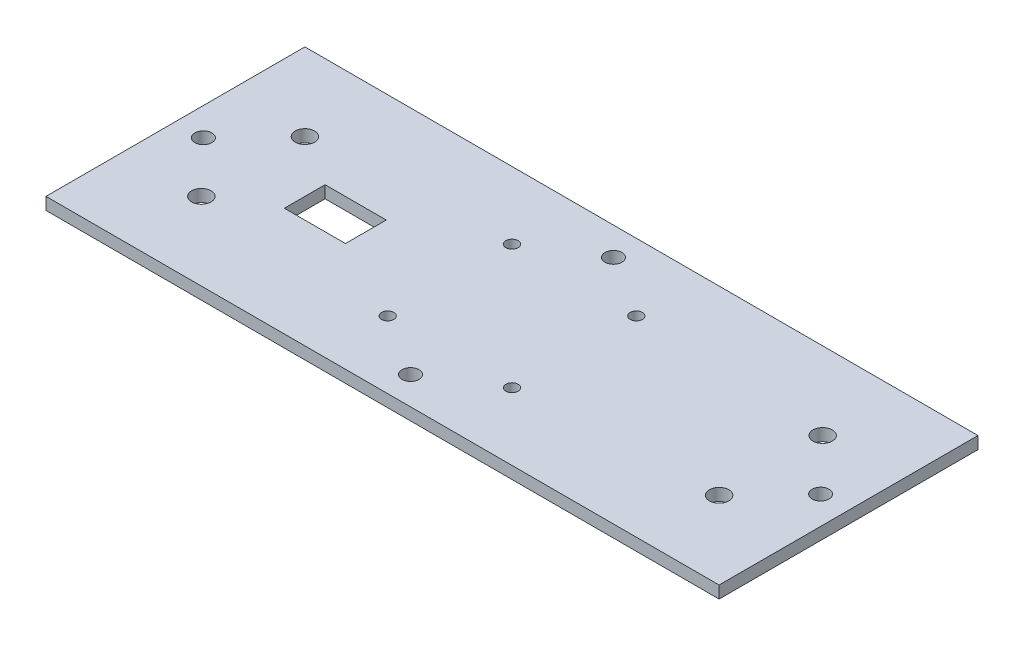
from build123d import *

# Parameters (mm, degrees)
SKETCH1_W           = 165.1
SKETCH1_H           = 63.5
BOSS_EXTRUDE1_DEPTH = 3
CUT_EXTRUDE1_REACH  = 90.496
SKETCH6_R           = 1.5
SKETCH6_W           = 15
SKETCH6_H           = 10
CUT_EXTRUDE3_REACH  = 90.496
SKETCH8_R           = 2.38125
SKETCH9_R           = 2.0828
CUT_EXTRUDE5_DEPTH  = 5.08
SKETCH10_R          = 2.0828
CUT_EXTRUDE6_DEPTH  = 5.08


with BuildPart() as part:
    # Sketch1 → Boss-Extrude1 (new body)
    with BuildSketch(Plane(origin=(0, 0, 0), x_dir=(1, 0, 0), z_dir=(0, 1, 0))):
        Rectangle(SKETCH1_W, SKETCH1_H)
    extrude(amount=BOSS_EXTRUDE1_DEPTH)

    # Sketch6 → Cut-Extrude1 (cut, up to next)
    with BuildSketch(Plane.XZ, mode=Mode.PRIVATE) as cut_extrude1_sk1:
        with Locations((-15.25, 15.25)):
            Circle(SKETCH6_R)
    cut_extrude1_tool1 = extrude(cut_extrude1_sk1.sketch, amount=-CUT_EXTRUDE1_REACH, mode=Mode.PRIVATE) & part.part
    # Sketch6 → Cut-Extrude1 (cut, up to next)
    with BuildSketch(Plane.XZ, mode=Mode.PRIVATE) as cut_extrude1_sk2:
        with Locations((15.25, 15.25)):
            Circle(SKETCH6_R)
    cut_extrude1_tool2 = extrude(cut_extrude1_sk2.sketch, amount=-CUT_EXTRUDE1_REACH, mode=Mode.PRIVATE) & part.part
    # Sketch6 → Cut-Extrude1 (cut, up to next)
    with BuildSketch(Plane.XZ, mode=Mode.PRIVATE) as cut_extrude1_sk3:
        with Locations((-15.25, -15.25)):
            Circle(SKETCH6_R)
    cut_extrude1_tool3 = extrude(cut_extrude1_sk3.sketch, amount=-CUT_EXTRUDE1_REACH, mode=Mode.PRIVATE) & part.part
    # Sketch6 → Cut-Extrude1 (cut, up to next)
    with BuildSketch(Plane.XZ, mode=Mode.PRIVATE) as cut_extrude1_sk4:
        with Locations((15.25, -15.25)):
            Circle(SKETCH6_R)
    cut_extrude1_tool4 = extrude(cut_extrude1_sk4.sketch, amount=-CUT_EXTRUDE1_REACH, mode=Mode.PRIVATE) & part.part
    # Sketch6 → Cut-Extrude1 (cut, up to next)
    with BuildSketch(Plane.XZ, mode=Mode.PRIVATE) as cut_extrude1_sk5:
        with Locations((-43.3, 0.047)):
            Rectangle(SKETCH6_W, SKETCH6_H)
    cut_extrude1_tool5 = extrude(cut_extrude1_sk5.sketch, amount=-CUT_EXTRUDE1_REACH, mode=Mode.PRIVATE) & part.part
    add(cut_extrude1_tool1.solids().sort_by_distance((-15.25, 0, 15.25))[0], mode=Mode.SUBTRACT)
    add(cut_extrude1_tool2.solids().sort_by_distance((15.25, 0, 15.25))[0], mode=Mode.SUBTRACT)
    add(cut_extrude1_tool3.solids().sort_by_distance((-15.25, 0, -15.25))[0], mode=Mode.SUBTRACT)
    add(cut_extrude1_tool4.solids().sort_by_distance((15.25, 0, -15.25))[0], mode=Mode.SUBTRACT)
    add(cut_extrude1_tool5.solids().sort_by_distance((-43.3, 0, 0.047))[0], mode=Mode.SUBTRACT)

    # Sketch8 → Cut-Extrude3 (cut, up to next)
    with BuildSketch(Plane(origin=(0, 3, 0), x_dir=(1, 0, 0), z_dir=(0, 1, 0)), mode=Mode.PRIVATE) as cut_extrude3_sk1:
        with Locations((-63.5, -12.7)):
            Circle(SKETCH8_R)
    cut_extrude3_tool1 = extrude(cut_extrude3_sk1.sketch, amount=-CUT_EXTRUDE3_REACH, mode=Mode.PRIVATE) & part.part
    # Sketch8 → Cut-Extrude3 (cut, up to next)
    with BuildSketch(Plane(origin=(0, 3, 0), x_dir=(1, 0, 0), z_dir=(0, 1, 0)), mode=Mode.PRIVATE) as cut_extrude3_sk2:
        with Locations((-63.5, 12.7)):
            Circle(SKETCH8_R)
    cut_extrude3_tool2 = extrude(cut_extrude3_sk2.sketch, amount=-CUT_EXTRUDE3_REACH, mode=Mode.PRIVATE) & part.part
    # Sketch8 → Cut-Extrude3 (cut, up to next)
    with BuildSketch(Plane(origin=(0, 3, 0), x_dir=(1, 0, 0), z_dir=(0, 1, 0)), mode=Mode.PRIVATE) as cut_extrude3_sk3:
        with Locations((63.5, 12.7)):
            Circle(SKETCH8_R)
    cut_extrude3_tool3 = extrude(cut_extrude3_sk3.sketch, amount=-CUT_EXTRUDE3_REACH, mode=Mode.PRIVATE) & part.part
    # Sketch8 → Cut-Extrude3 (cut, up to next)
    with BuildSketch(Plane(origin=(0, 3, 0), x_dir=(1, 0, 0), z_dir=(0, 1, 0)), mode=Mode.PRIVATE) as cut_extrude3_sk4:
        with Locations((63.5, -12.7)):
            Circle(SKETCH8_R)
    cut_extrude3_tool4 = extrude(cut_extrude3_sk4.sketch, amount=-CUT_EXTRUDE3_REACH, mode=Mode.PRIVATE) & part.part
    add(cut_extrude3_tool1.solids().sort_by_distance((-63.5, 3, 12.7))[0], mode=Mode.SUBTRACT)
    add(cut_extrude3_tool2.solids().sort_by_distance((-63.5, 3, -12.7))[0], mode=Mode.SUBTRACT)
    add(cut_extrude3_tool3.solids().sort_by_distance((63.5, 3, -12.7))[0], mode=Mode.SUBTRACT)
    add(cut_extrude3_tool4.solids().sort_by_distance((63.5, 3, 12.7))[0], mode=Mode.SUBTRACT)

    # Sketch9 → Cut-Extrude5 (cut)
    with BuildSketch(Plane(origin=(0, 3, 0), x_dir=(1, 0, 0), z_dir=(0, 1, 0))):
        with Locations((-75.692, 0)):
            Circle(SKETCH9_R)
        with Locations((75.692, 0)):
            Circle(SKETCH9_R)
    extrude(amount=-CUT_EXTRUDE5_DEPTH, mode=Mode.SUBTRACT)

    # Sketch10 → Cut-Extrude6 (cut)
    with BuildSketch(Plane(origin=(0, 3, 0), x_dir=(1, 0, 0), z_dir=(0, 1, 0))):
        with Locations((0, -24.892)):
            Circle(SKETCH10_R)
        with Locations((0, 24.892)):
            Circle(SKETCH10_R)
    extrude(amount=-CUT_EXTRUDE6_DEPTH, mode=Mode.SUBTRACT)


solid = part.part
